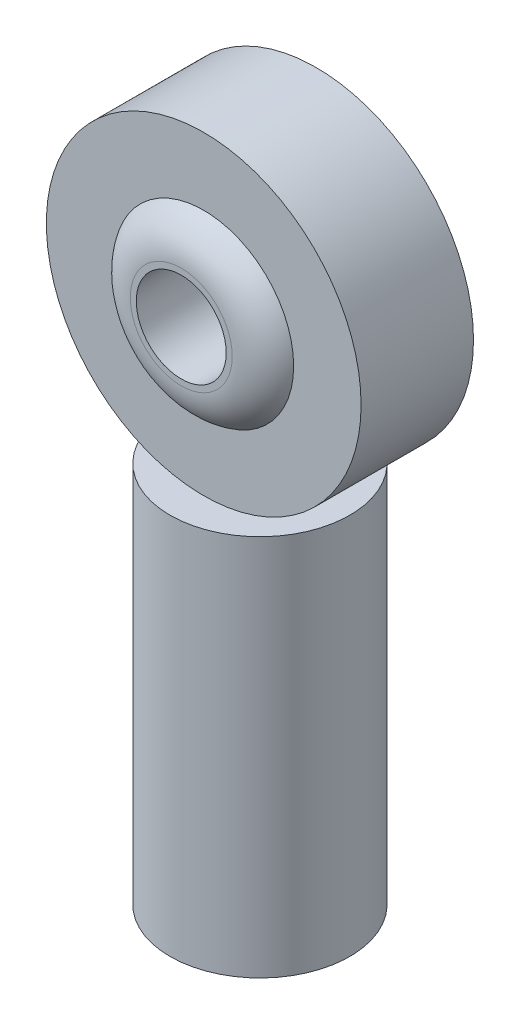
from build123d import *

# Parameters (mm, degrees)
EXTRUDE_1_DEPTH      = 2.5
EXTRUDE_1_DEPTH_BACK = 2.5
SKETCH_1_R           = 7
SKETCH_4_R           = 4
EXTRUDE_2_DEPTH      = 17
SKETCH_5_R           = 2
CUT_EXTRUDE_1_DEPTH  = 12
EXTRUDE_3_DEPTH      = 3.5
EXTRUDE_3_DEPTH_BACK = 3.5
SKETCH_7_R           = 4
SKETCH_8_R           = 2
CUT_EXTRUDE_2_DEPTH  = 27.100766272
FILLET_2_R           = 2


with BuildPart() as part:
    # Эскиз1 → Бобышка-Вытянуть1 (new, two sides: drawn at the far end of the back side and taken through both)
    with BuildSketch(Plane.XY.offset(-EXTRUDE_1_DEPTH_BACK)):
        Circle(SKETCH_1_R)
    extrude(amount=EXTRUDE_1_DEPTH + EXTRUDE_1_DEPTH_BACK)

    # Эскиз7 → Бобышка-Вытянуть3 (add, two sides: drawn at the far end of the back side and taken through both)
    with BuildSketch(Plane.XY.offset(-EXTRUDE_3_DEPTH_BACK)):
        Circle(SKETCH_7_R)
    extrude(amount=EXTRUDE_3_DEPTH + EXTRUDE_3_DEPTH_BACK)

    # Эскиз8 → Вырез-Вытянуть2 (cut, through all)
    with BuildSketch(Plane.XY.offset(3.5)):
        Circle(SKETCH_8_R)
    extrude(amount=-CUT_EXTRUDE_2_DEPTH, mode=Mode.SUBTRACT)

    # Скругление2
    # the kernel refuses this fillet: 2 mm, written as the material it takes off along each edge
    with BuildSketch(Plane(origin=(0, 0, -3.5), x_dir=(1, 0, 0), z_dir=(0, -1, 0))) as fillet_2_piece_1:
        with BuildLine():
            CenterArc((2.267949192, 2), FILLET_2_R, 270, 60)
            Line((2.267949192, 0), (2.267949192, -0.04))
            Line((2.267949192, -0.04), (4, -0.04))
            Line((4, -0.04), (4.04, 0))
            ThreePointArc((4.04, 0), (4.04, 0.5), (4.034641016, 0.98))
            Line((4.034641016, 0.98), (4, 1))
        make_face()
    revolve(axis=Axis((0, 0, -3.5), (0, 0, 1)), mode=Mode.SUBTRACT)
    with BuildSketch(Plane(origin=(0, 0, 3.5), x_dir=(1, 0, 0), z_dir=(0, -1, 0))) as fillet_2_piece_2:
        with BuildLine():
            CenterArc((2.267949192, -2), FILLET_2_R, 30, 60)
            Line((2.267949192, 0), (2.267949192, 0.04))
            Line((2.267949192, 0.04), (4, 0.04))
            Line((4, 0.04), (4.04, 0))
            ThreePointArc((4.04, 0), (4.04, -0.5), (4.034641016, -0.98))
            Line((4.034641016, -0.98), (4, -1))
        make_face()
    revolve(axis=Axis((0, 0, 3.5), (0, 0, 1)), mode=Mode.SUBTRACT)


with BuildPart() as body_2:
    # Эскиз4 → Бобышка-Вытянуть2 (new body)
    with BuildSketch(Plane(origin=(0, -7, 0), x_dir=(1, 0, 0), z_dir=(0, 1, 0))):
        with Locations(Location((0, 0, 0), (0, 0, 270))):
            Circle(SKETCH_4_R)
    extrude(amount=-EXTRUDE_2_DEPTH)

    # Эскиз5 → Вырез-Вытянуть1 (cut)
    with BuildSketch(Plane.XZ.offset(24)):
        with Locations(Location((0, 0, 0), (0, 0, 270))):
            Circle(SKETCH_5_R)
    extrude(amount=-CUT_EXTRUDE_1_DEPTH, mode=Mode.SUBTRACT)


solid = Compound([part.part, body_2.part])
